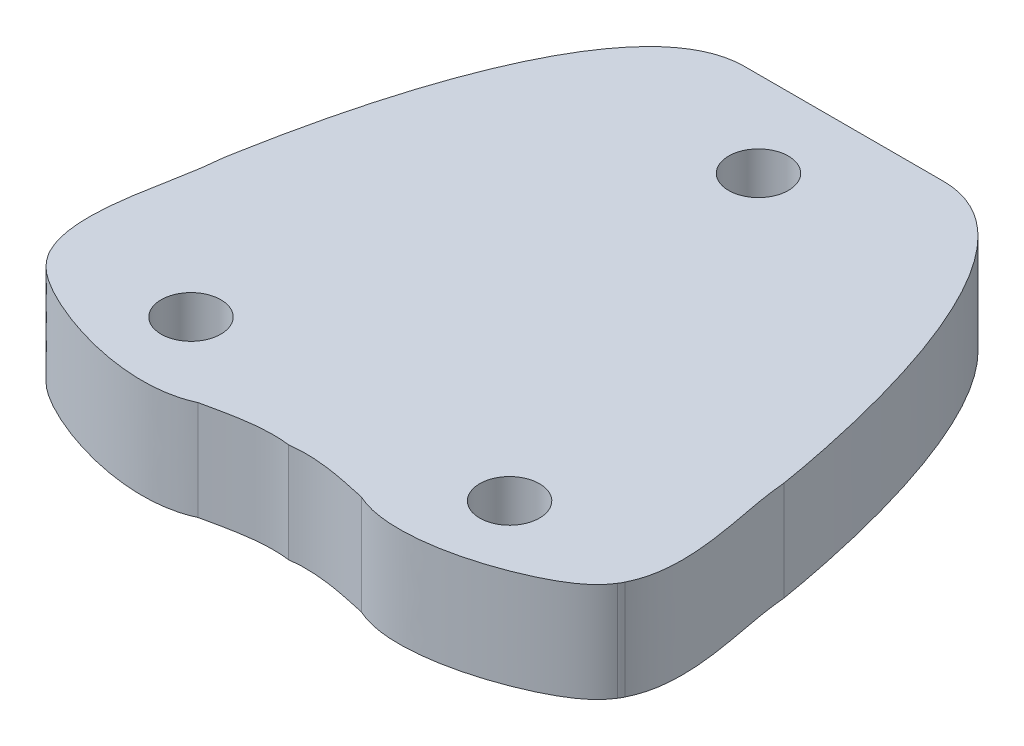
from build123d import *

# Parameters (mm, degrees)
CROQUIS1_R                  = 16.5
CROQUIS1_R_2                = 3.75
CROQUIS1_R_3                = 1.5
SALIENTE_EXTRUIR1_DEPTH     = 5
CROQUIS2_R                  = 5.5
CORTAR_EXTRUIR1_DEPTH       = 2
CORTAR_EXTRUIR2_START       = -5
CROQUIS4_R                  = 3
CORTAR_EXTRUIR2_DEPTH       = 2.5
CROQUIS6_R                  = 1.5
SALIENTE_EXTRUIR3_DEPTH     = 5
SALIENTE_EXTRUIR4_START     = -5
SALIENTE_EXTRUIR4_DEPTH     = 5
CORTAR_EXTRUIR3_START       = -5
CORTAR_EXTRUIR3_OUTLINE_R   = 1.5
CORTAR_EXTRUIR3_OUTLINE_R_2 = 3.75
CORTAR_EXTRUIR3_DEPTH       = 5


# Read off the part's stored shape, not the designer's step: Saliente-Extruir4, Cortar-Extruir3
with BuildPart() as part:
    # Croquis1 → Saliente-Extruir1 (new body)
    with BuildSketch(Plane(origin=(0, 0, 0), x_dir=(1, 0, 0), z_dir=(0, 1, 0))):
        with Locations(Location((0, 0, 0), (0, 0, 270))):
            Circle(CROQUIS1_R)
        with Locations(Location((0, 0, 0), (0, 0, 270))):
            Circle(CROQUIS1_R_2, mode=Mode.SUBTRACT)
        with Locations(Location((10, 0, 0), (0, 0, 270))):
            Circle(CROQUIS1_R_3, mode=Mode.SUBTRACT)
        with Locations(Location((0, -10, 0), (0, 0, 270))):
            Circle(CROQUIS1_R_3, mode=Mode.SUBTRACT)
        with Locations(Location((-10, 0, 0), (0, 0, 270))):
            Circle(CROQUIS1_R_3, mode=Mode.SUBTRACT)
        with Locations(Location((0, 10, 0), (0, 0, 270))):
            Circle(CROQUIS1_R_3, mode=Mode.SUBTRACT)
    extrude(amount=SALIENTE_EXTRUIR1_DEPTH)

    # Croquis2 → Cortar-Extruir1 (cut)
    with BuildSketch(Plane(origin=(0, 5, 0), x_dir=(1, 0, 0), z_dir=(0, 1, 0))):
        with Locations(Location((0, 0, 0), (0, 0, 270))):
            Circle(CROQUIS2_R)
    extrude(amount=-CORTAR_EXTRUIR1_DEPTH, mode=Mode.SUBTRACT)

    # Croquis4 → Cortar-Extruir2 (cut)
    with BuildSketch(Plane(origin=(0, 5, 0), x_dir=(1, 0, 0), z_dir=(0, 1, 0)).offset(CORTAR_EXTRUIR2_START)):
        with Locations(Location((10, 0, 0), (0, 0, 270))):
            Circle(CROQUIS4_R)
        with Locations(Location((-10, 0, 0), (0, 0, 270))):
            Circle(CROQUIS4_R)
        with Locations(Location((0, 10, 0), (0, 0, 270))):
            Circle(CROQUIS4_R)
    extrude(amount=CORTAR_EXTRUIR2_DEPTH, mode=Mode.SUBTRACT)

    # Croquis6 → Saliente-Extruir3 (add)
    with BuildSketch(Plane(origin=(0, 5, 0), x_dir=(1, 0, 0), z_dir=(0, 1, 0))):
        with BuildLine():
            Line((-16.499999253, -0.004966275), (0, -15.162135144))
            Line((0, -15.162135144), (16.499999253, -0.004966275))
            add(Edge.make_bspline(
                [(16.499999253, -0.004966275), (14.789720677, -16.601874141), (14.779811161, -16.438973164), (14.200732618, -20.551745369), (13.635520661, -22.485602375), (15.733267293, -30.419610193), (11.37636727, -34.073606125), (1.56418736, -36.497980996), (2.416281914, -27.975905143), (1.888822796, -23.5), (0, -23.5)],
                knots=[0, 0, 0, 0, 0.196162037, 0.24321543, 0.470533934, 0.661030556, 0.708413553, 0.918147195, 0.949927511, 1, 1, 1, 1], degree=3))
            add(Edge.make_bspline(
                [(-16.499999253, -0.004966275), (-14.789720677, -16.601874141), (-14.779811161, -16.438973164), (-14.200732618, -20.551745369), (-13.635520661, -22.485602375), (-15.733267293, -30.419610193), (-11.37636727, -34.073606125), (-1.56418736, -36.497980996), (-2.416281914, -27.975905143), (-1.888822796, -23.5), (0, -23.5)],
                knots=[0, 0, 0, 0, 0.196162037, 0.24321543, 0.470533934, 0.661030556, 0.708413553, 0.918147195, 0.949927511, 1, 1, 1, 1], degree=3))
        make_face()
        with Locations(Location((-8, -30.5, 0), (0, 0, 270))):
            Circle(CROQUIS6_R, mode=Mode.SUBTRACT)
        with Locations(Location((8, -30.5, 0), (0, 0, 90))):
            Circle(CROQUIS6_R, mode=Mode.SUBTRACT)
    extrude(amount=-SALIENTE_EXTRUIR3_DEPTH)

    # Saliente-Extruir4 outline → Saliente-Extruir4 (add)
    with BuildSketch(Plane(origin=(0, 5, 0), x_dir=(1, 0, 0), z_dir=(0, 1, 0)).offset(SALIENTE_EXTRUIR4_START)):
        with BuildLine():
            add(Edge.make_bspline(
                [(14.291966708, -31.373017759), (14.340514678, -31.295086469), (14.385698727, -31.215084368), (14.427688557, -31.133168853)],
                knots=[0.343293779, 0.343293779, 0.343293779, 0.343293779, 0.350896071, 0.350896071, 0.350896071, 0.350896071], degree=3))
            add(Edge.make_bspline(
                [(14.291966708, -31.373017759), (14.349575443, -31.290166182), (14.395146457, -31.209972546), (14.427688557, -31.133168853)],
                knots=[0.96489404, 0.96489404, 0.96489404, 0.96489404, 1, 1, 1, 1], degree=3))
        make_face()
        with BuildLine():
            add(Edge.make_bspline(
                [(-14.427688557, -31.133168853), (-14.395146457, -31.209972546), (-14.349575443, -31.290166182), (-14.291966708, -31.373017759)],
                knots=[0, 0, 0, 0, 0.03510596, 0.03510596, 0.03510596, 0.03510596], degree=3))
            add(Edge.make_bspline(
                [(-14.427688557, -31.133168853), (-14.385698727, -31.215084368), (-14.340514678, -31.295086469), (-14.291966708, -31.373017759)],
                knots=[0.649103929, 0.649103929, 0.649103929, 0.649103929, 0.656706221, 0.656706221, 0.656706221, 0.656706221], degree=3))
        make_face()
        with BuildLine():
            add(Edge.make_bspline(
                [(0, -33.607159893), (1.397517326, -33.429434313), (2.728240909, -33.755145964), (4.099311118, -34.046838013)],
                knots=[0, 0, 0, 0, 0.263268598, 0.263268598, 0.263268598, 0.263268598], degree=3))
            add(Edge.make_bspline(
                [(0, -23.5), (1.888822796, -23.5), (2.416281914, -27.975905143), (1.994660589, -32.192677678), (3.074818283, -33.563655557), (4.099311118, -34.046838013)],
                knots=[0, 0, 0, 0, 0.050072489, 0.081852805, 0.144278664, 0.144278664, 0.144278664, 0.144278664], degree=3))
            add(Edge.make_bspline(
                [(-4.099311115, -34.046838012), (-3.074818281, -33.563655555), (-1.994660589, -32.192677676), (-2.416281914, -27.975905143), (-1.888822796, -23.5), (0, -23.5)],
                knots=[0.855721336, 0.855721336, 0.855721336, 0.855721336, 0.918147195, 0.949927511, 1, 1, 1, 1], degree=3))
            add(Edge.make_bspline(
                [(-4.099311115, -34.046838012), (-2.728240907, -33.755145963), (-1.397517325, -33.429434314), (0, -33.607159893)],
                knots=[0.736731402, 0.736731402, 0.736731402, 0.736731402, 1, 1, 1, 1], degree=3))
        make_face()
    extrude(amount=SALIENTE_EXTRUIR4_DEPTH)

    # Cortar-Extruir3 outline → Cortar-Extruir3 (cut)
    with BuildSketch(Plane(origin=(0, 5, 0), x_dir=(1, 0, 0), z_dir=(0, 1, 0)).offset(CORTAR_EXTRUIR3_START)):
        with BuildLine():
            add(Edge.make_bspline(
                [(-5, -5.704095984), (-6.82751306, -5.704095984), (-11.278769384, -9.499460435), (-13.360021763, -18.603666683), (-13.970897338, -21.999566183)],
                knots=[0, 0, 0, 0, 0.255170628, 0.749384094, 0.749384094, 0.749384094, 0.749384094], degree=3))
            Line((-5, -5.704095984), (5, -5.704095984))
            add(Edge.make_bspline(
                [(5, -5.704095984), (10.679811422, -5.704095984), (13.347569143, -18.187313933), (14.115183744, -22.835331636)],
                knots=[0, 0, 0, 0, 0.793056467, 0.793056467, 0.793056467, 0.793056467], degree=3))
            add(Edge.make_bspline(
                [(14.115183744, -22.835331636), (13.982038213, -21.263217458), (14.258823228, -20.139170168), (14.762278608, -16.563494089), (14.787566831, -16.590643141), (16.153585525, -3.36328332)],
                knots=[0.576667959, 0.576667959, 0.576667959, 0.576667959, 0.75678457, 0.803837963, 0.985753813, 0.985753813, 0.985753813, 0.985753813], degree=3))
            ThreePointArc((16.153585525, -3.36328332), (0, 16.5), (-16.153585525, -3.36328332))
            add(Edge.make_bspline(
                [(-16.153585525, -3.36328332), (-14.787566831, -16.590643141), (-14.762278608, -16.563494089), (-14.261753936, -20.118355485), (-13.987841454, -21.239556576), (-14.110086789, -22.773329956)],
                knots=[0.014246187, 0.014246187, 0.014246187, 0.014246187, 0.196162037, 0.24321543, 0.420950675, 0.420950675, 0.420950675, 0.420950675], degree=3))
            Line((-14.110086789, -22.773329956), (-13.970897338, -21.999566183))
        make_face()
        with Locations((-10, 0)):
            Circle(CORTAR_EXTRUIR3_OUTLINE_R, mode=Mode.SUBTRACT)
        Circle(CORTAR_EXTRUIR3_OUTLINE_R_2, mode=Mode.SUBTRACT)
        with Locations((10, 0)):
            Circle(CORTAR_EXTRUIR3_OUTLINE_R, mode=Mode.SUBTRACT)
        with Locations((0, 10)):
            Circle(CORTAR_EXTRUIR3_OUTLINE_R, mode=Mode.SUBTRACT)
    extrude(amount=CORTAR_EXTRUIR3_DEPTH, mode=Mode.SUBTRACT)


solid = part.part
